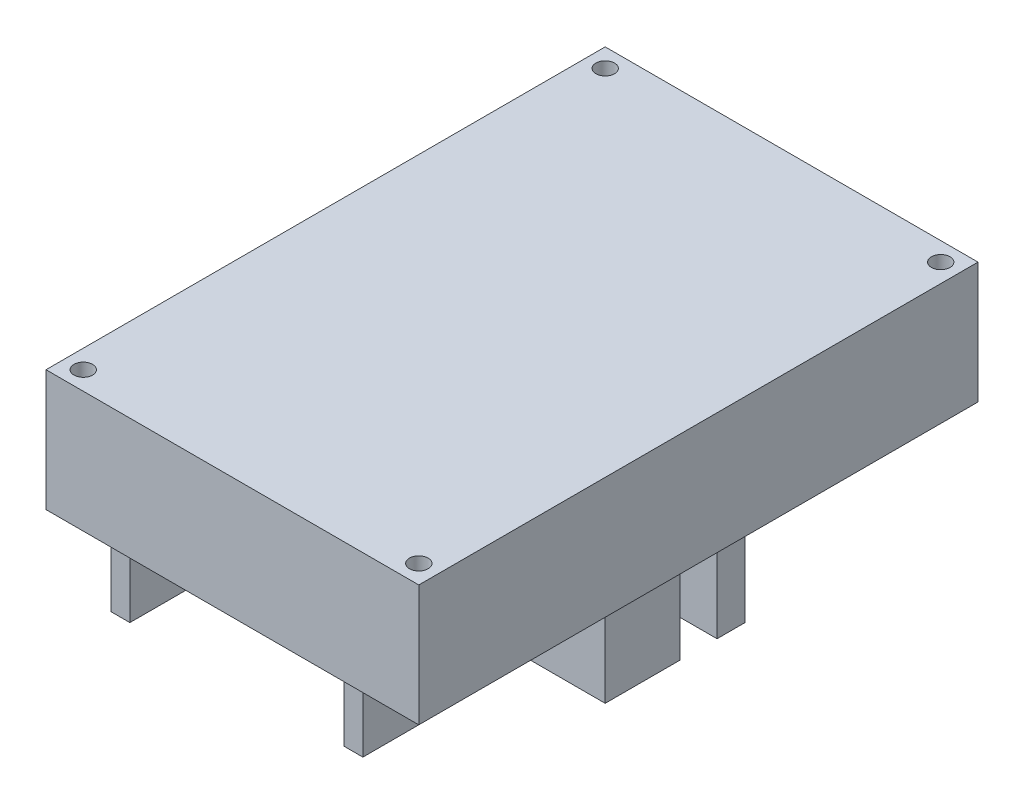
from build123d import *

# Parameters (mm, degrees)
ESQUISSE1_W        = 40
ESQUISSE1_H        = 60
ESQUISSE1_R        = 1
BOSS_EXTRU_1_DEPTH = 6.5
ESQUISSE3_W        = 2
ESQUISSE3_H        = 47
BOSS_EXTRU_2_DEPTH = 10


with BuildPart() as part:
    # Esquisse1 → Boss.-Extru.1 (new, symmetric)
    with BuildSketch(Plane(origin=(0, 0, 0), x_dir=(1, 0, 0), z_dir=(0, 1, 0))):
        Rectangle(ESQUISSE1_W, ESQUISSE1_H)
        with Locations((-18, 28)):
            Circle(ESQUISSE1_R, mode=Mode.SUBTRACT)
        with Locations((18, 28)):
            Circle(ESQUISSE1_R, mode=Mode.SUBTRACT)
        with Locations((18, -28)):
            Circle(ESQUISSE1_R, mode=Mode.SUBTRACT)
        with Locations((-18, -28)):
            Circle(ESQUISSE1_R, mode=Mode.SUBTRACT)
    extrude(amount=BOSS_EXTRU_1_DEPTH, both=True)

    # Esquisse3 → Boss.-Extru.2 (add)
    with BuildSketch(Plane.XZ.offset(6.5)):
        with Locations((-16, 2.5)):
            Rectangle(ESQUISSE3_W, ESQUISSE3_H)
        Polygon((10, 26), (8, 26), (8, -21), (10, -21), (10, -7), (18, -7), (18, -4), (10, -4), (10, 0), (18, 0), (18, 8), (10, 8), align=None)
    extrude(amount=BOSS_EXTRU_2_DEPTH)


solid = part.part
